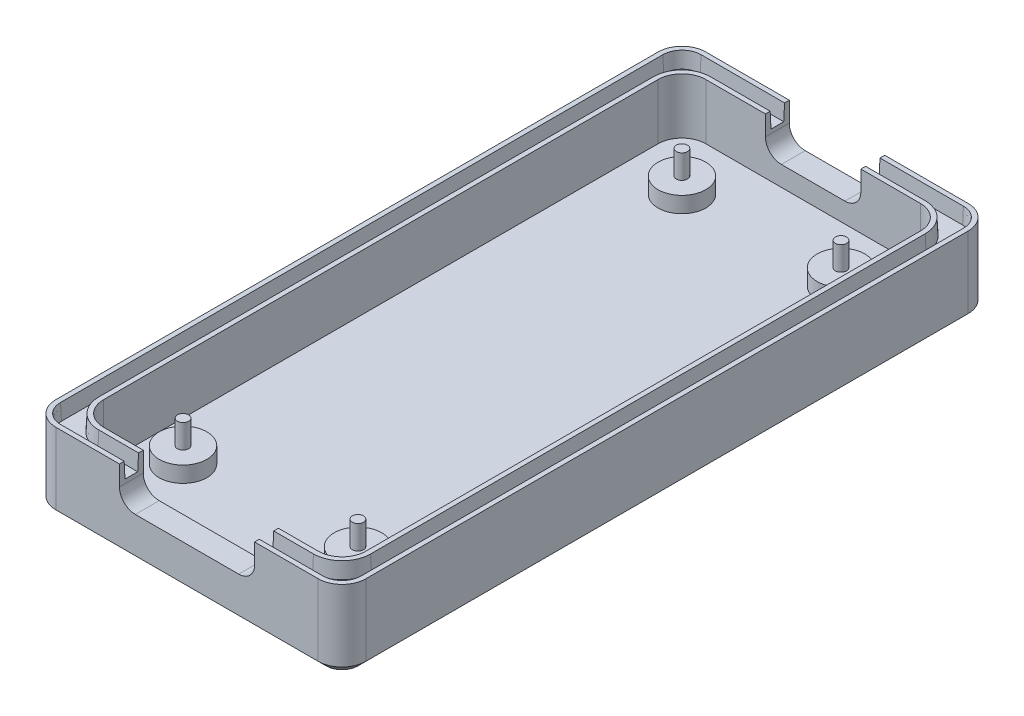
from build123d import *

# Parameters (mm, degrees)
SKETCH1_W                       = 39
SKETCH1_H                       = 81.75
SKETCH1_R                       = 3
BOSS_EXTRUDE1_DEPTH             = 3
SKETCH3_W                       = 39
SKETCH3_H                       = 81.75
SKETCH3_W_2                     = 33
SKETCH3_H_2                     = 75.75
BOSS_EXTRUDE3_DEPTH             = 5
BOSS_EXTRUDE4_START             = 3
SKETCH1_3_R                     = 3
BOSS_EXTRUDE4_DEPTH             = 2
SKETCH8_R                       = 0.7
BOARD_MOUNTING_STANDOFFS_DEPTH  = 3
TAP_DRILL_FOR_M2X0_4_TAP1_D     = 1.6
TAP_DRILL_FOR_M2X0_4_TAP1_DEPTH = 4.519311505
TAP_DRILL_FOR_M2X0_4_TAP1_TIP   = 0.480688495
FILLET2_R                       = 3
SKETCH6_W                       = 12
SKETCH6_H                       = 3
SKETCH6_W_2                     = 17
CUT_EXTRUDE1_DEPTH              = 2.5
STANDOFFS1_LIP_START            = 8
STANDOFFS1_LIP_DEPTH            = 2
STANDOFFS2_LIP_START            = 8
STANDOFFS2_LIP_DEPTH            = 2
FILLET4_R                       = 2
CHAMFER1_SIZE                   = 1


with BuildPart() as part:
    # Sketch1 → Boss-Extrude1 (new body)
    # profile 1 of 5: a face of its own
    with BuildSketch(Plane(origin=(0, 0, 0), x_dir=(1, 0, 0), z_dir=(0, 1, 0))):
        with Locations((14.5, 35.875)):
            Rectangle(SKETCH1_W, SKETCH1_H)
        with Locations((3, 6)):
            Circle(SKETCH1_R, mode=Mode.SUBTRACT)
        with Locations((25, 6)):
            Circle(SKETCH1_R, mode=Mode.SUBTRACT)
        with Locations((5, 66.75)):
            Circle(SKETCH1_R, mode=Mode.SUBTRACT)
        with Locations((25, 66.75)):
            Circle(SKETCH1_R, mode=Mode.SUBTRACT)
    # profile 2 of 5: a face of its own
    with BuildSketch(Plane(origin=(0, 0, 0), x_dir=(1, 0, 0), z_dir=(0, 1, 0))):
        with Locations((5, 66.75)):
            Circle(SKETCH1_R)
    # profile 3 of 5: a face of its own
    with BuildSketch(Plane(origin=(0, 0, 0), x_dir=(1, 0, 0), z_dir=(0, 1, 0))):
        with Locations((25, 66.75)):
            Circle(SKETCH1_R)
    # profile 4 of 5: a face of its own
    with BuildSketch(Plane(origin=(0, 0, 0), x_dir=(1, 0, 0), z_dir=(0, 1, 0))):
        with Locations((25, 6)):
            Circle(SKETCH1_R)
    # profile 5 of 5: a face of its own
    with BuildSketch(Plane(origin=(0, 0, 0), x_dir=(1, 0, 0), z_dir=(0, 1, 0))):
        with Locations((3, 6)):
            Circle(SKETCH1_R)
    extrude(amount=BOSS_EXTRUDE1_DEPTH)

    # Sketch3 → Boss-Extrude3 (add)
    with BuildSketch(Plane(origin=(0, 3, 0), x_dir=(1, 0, 0), z_dir=(0, 1, 0))):
        with Locations((14.5, 35.875)):
            Rectangle(SKETCH3_W, SKETCH3_H)
        with Locations((14.5, 35.875)):
            Rectangle(SKETCH3_W_2, SKETCH3_H_2, mode=Mode.SUBTRACT)
    extrude(amount=BOSS_EXTRUDE3_DEPTH)

    # Sketch1<3> → Boss-Extrude4 (add)
    with BuildSketch(Plane(origin=(0, 0, 0), x_dir=(1, 0, 0), z_dir=(0, 1, 0)).offset(BOSS_EXTRUDE4_START)):
        with Locations(Location((3, 6, 0), (0, 0, 270))):
            Circle(SKETCH1_3_R)
        with Locations(Location((25, 6, 0), (0, 0, 270))):
            Circle(SKETCH1_3_R)
        with Locations(Location((25, 66.75, 0), (0, 0, 270))):
            Circle(SKETCH1_3_R)
        with Locations(Location((5, 66.75, 0), (0, 0, 270))):
            Circle(SKETCH1_3_R)
    extrude(amount=BOSS_EXTRUDE4_DEPTH)

    # Sketch8 → Board Mounting Standoffs (add)
    with BuildSketch(Plane(origin=(0, 5, 0), x_dir=(1, 0, 0), z_dir=(0, 1, 0))):
        with Locations(Location((5, 66.75, 0), (0, 0, 270))):
            Circle(SKETCH8_R)
        with Locations(Location((25, 66.75, 0), (0, 0, 270))):
            Circle(SKETCH8_R)
        with Locations(Location((3, 6, 0), (0, 0, 270))):
            Circle(SKETCH8_R)
        with Locations(Location((25, 6, 0), (0, 0, 270))):
            Circle(SKETCH8_R)
    extrude(amount=BOARD_MOUNTING_STANDOFFS_DEPTH)

    # Tap Drill for M2x0.4 Tap1
    with Locations(Plane(origin=(0, 0, 0), x_dir=(-1, 0, 0), z_dir=(0, -1, 0))):
        with Locations((-25, 66.75), (-5, 66.75), (-25, 6), (-3, 6)):
            Hole(TAP_DRILL_FOR_M2X0_4_TAP1_D / 2, depth=TAP_DRILL_FOR_M2X0_4_TAP1_DEPTH)
            with Locations((0, 0, -(TAP_DRILL_FOR_M2X0_4_TAP1_DEPTH + TAP_DRILL_FOR_M2X0_4_TAP1_TIP / 2))):  # 118° drill point
                Cone(0, TAP_DRILL_FOR_M2X0_4_TAP1_D / 2, TAP_DRILL_FOR_M2X0_4_TAP1_TIP, mode=Mode.SUBTRACT)

    # Fillet2
    fillet2_edges = [part.edges().sort_by_distance(p)[0] for p in [
        (-2, 5.5, -73.75),
        (-2, 5.5, 2),
        (31, 5.5, 2),
        (31, 5.5, -73.75),
        (-5, 4, -76.75),
        (34, 4, -76.75),
        (34, 4, 5),
        (-5, 4, 5),
    ]]
    fillet(fillet2_edges, radius=FILLET2_R)

    # Sketch6 → Cut-Extrude1 (cut)
    with BuildSketch(Plane(origin=(0, 8, 0), x_dir=(1, 0, 0), z_dir=(0, 1, 0))):
        with Locations((14.5, 75.25)):
            Rectangle(SKETCH6_W, SKETCH6_H)
        with Locations((14.5, -3.5)):
            Rectangle(SKETCH6_W_2, SKETCH6_H)
    extrude(amount=-CUT_EXTRUDE1_DEPTH, mode=Mode.SUBTRACT)

    # Standoffs1-Lip: read off the stored shape, not the designer's step
    # Standoffs1-Lip outline → Standoffs1-Lip (add)
    with BuildSketch(Plane(origin=(0, 0, 0), x_dir=(1, 0, 0), z_dir=(0, 1, 0)).offset(STANDOFFS1_LIP_START)):
        with BuildLine():
            Line((23, -5), (31, -5))
            ThreePointArc((31, -5), (33.121320344, -4.121320344), (34, -2))
            Line((34, -2), (34, 73.75))
            ThreePointArc((34, 73.75), (33.121320344, 75.871320344), (31, 76.75))
            Line((31, 76.75), (20.5, 76.75))
            Line((20.5, 76.75), (20.5, 73.75))
            Line((20.5, 73.75), (28, 73.75))
            ThreePointArc((28, 73.75), (30.121320344, 72.871320344), (31, 70.75))
            Line((31, 70.75), (31, 1))
            ThreePointArc((31, 1), (30.121320344, -1.121320344), (28, -2))
            Line((28, -2), (23, -2))
            Line((23, -2), (23, -5))
        make_face()
    extrude(amount=STANDOFFS1_LIP_DEPTH)

    # Standoffs1-Lip 2: loft between two sections, ruled curve by curve
    standoffs1_lip_2_from = [
        Edge.make_three_point_arc((33.3, 8, -73.75), (32.626345597, 8, -75.376345597), (31, 8, -76.05)),
        Edge.make_three_point_arc((31, 8, 4.3), (32.626345597, 8, 3.626345597), (33.3, 8, 2)),
        Edge.make_three_point_arc((31.7, 8, -1), (30.61629509, 8, 1.61629509), (28, 8, 2.7)),
        Edge.make_three_point_arc((28, 8, -74.45), (30.61629509, 8, -73.36629509), (31.7, 8, -70.75)),
        Edge.make_line((20.5, 8, -76.05), (31, 8, -76.05)),
        Edge.make_line((33.3, 8, -73.75), (33.3, 8, 2)),
        Edge.make_line((31, 8, 4.3), (23, 8, 4.3)),
        Edge.make_line((20.5, 8, -74.45), (28, 8, -74.45)),
        Edge.make_line((28, 8, 2.7), (23, 8, 2.7)),
        Edge.make_line((31.7, 8, -70.75), (31.7, 8, -1)),
        Edge.make_line((20.5, 8, -74.45), (20.5, 8, -76.05)),
        Edge.make_line((23, 8, 2.7), (23, 8, 4.3)),
    ]
    standoffs1_lip_2_to = [
        Edge.make_three_point_arc((33.404815559, 10, -73.75), (32.700461389, 10, -75.450461389), (31, 10, -76.154815559)),
        Edge.make_three_point_arc((31, 10, 4.404815559), (32.700461389, 10, 3.700461389), (33.404815559, 10, 2)),
        Edge.make_three_point_arc((31.595184441, 10, -1), (30.542179298, 10, 1.542179298), (28, 10, 2.595184441)),
        Edge.make_three_point_arc((28, 10, -74.345184441), (30.542179298, 10, -73.292179298), (31.595184441, 10, -70.75)),
        Edge.make_line((20.5, 10, -76.154815559), (31, 10, -76.154815559)),
        Edge.make_line((33.404815559, 10, -73.75), (33.404815559, 10, 2)),
        Edge.make_line((31, 10, 4.404815559), (23, 10, 4.404815559)),
        Edge.make_line((20.5, 10, -74.345184441), (28, 10, -74.345184441)),
        Edge.make_line((28, 10, 2.595184441), (23, 10, 2.595184441)),
        Edge.make_line((31.595184441, 10, -70.75), (31.595184441, 10, -1)),
        Edge.make_line((20.5, 10, -74.345184441), (20.5, 10, -76.154815559)),
        Edge.make_line((23, 10, 2.595184441), (23, 10, 4.404815559)),
    ]
    standoffs1_lip_2 = Solid(Shell([*[Face.make_surface_from_curves(standoffs1_lip_2_from[k], standoffs1_lip_2_to[k]) for k in range(12)], Face(Wire(standoffs1_lip_2_from)), Face(Wire(standoffs1_lip_2_to))]))
    add(standoffs1_lip_2, mode=Mode.SUBTRACT)

    # Standoffs2-Lip: read off the stored shape, not the designer's step
    # Standoffs2-Lip outline → Standoffs2-Lip (add)
    with BuildSketch(Plane(origin=(0, 0, 0), x_dir=(1, 0, 0), z_dir=(0, 1, 0)).offset(STANDOFFS2_LIP_START)):
        with BuildLine():
            ThreePointArc((-2, 76.75), (-4.121320344, 75.871320344), (-5, 73.75))
            Line((-5, 73.75), (-5, -2))
            ThreePointArc((-5, -2), (-4.121320344, -4.121320344), (-2, -5))
            Line((-2, -5), (6, -5))
            Line((6, -5), (6, -2))
            Line((6, -2), (1, -2))
            ThreePointArc((1, -2), (-1.121320344, -1.121320344), (-2, 1))
            Line((-2, 1), (-2, 70.75))
            ThreePointArc((-2, 70.75), (-1.121320344, 72.871320344), (1, 73.75))
            Line((1, 73.75), (8.5, 73.75))
            Line((8.5, 73.75), (8.5, 76.75))
            Line((8.5, 76.75), (-2, 76.75))
        make_face()
    extrude(amount=STANDOFFS2_LIP_DEPTH)

    # Standoffs2-Lip 2: loft between two sections, ruled curve by curve
    standoffs2_lip_2_from = [
        Edge.make_three_point_arc((-4.3, 8, 2), (-3.626345597, 8, 3.626345597), (-2, 8, 4.3)),
        Edge.make_three_point_arc((-2, 8, -76.05), (-3.626345597, 8, -75.376345597), (-4.3, 8, -73.75)),
        Edge.make_three_point_arc((-2.7, 8, -70.75), (-1.61629509, 8, -73.36629509), (1, 8, -74.45)),
        Edge.make_three_point_arc((1, 8, 2.7), (-1.61629509, 8, 1.61629509), (-2.7, 8, -1)),
        Edge.make_line((-2, 8, -76.05), (8.5, 8, -76.05)),
        Edge.make_line((6, 8, 4.3), (-2, 8, 4.3)),
        Edge.make_line((1, 8, -74.45), (8.5, 8, -74.45)),
        Edge.make_line((6, 8, 2.7), (1, 8, 2.7)),
        Edge.make_line((-4.3, 8, 2), (-4.3, 8, -73.75)),
        Edge.make_line((-2.7, 8, -1), (-2.7, 8, -70.75)),
        Edge.make_line((8.5, 8, -74.45), (8.5, 8, -76.05)),
        Edge.make_line((6, 8, 2.7), (6, 8, 4.3)),
    ]
    standoffs2_lip_2_to = [
        Edge.make_three_point_arc((-4.404815559, 10, 2), (-3.700461389, 10, 3.700461389), (-2, 10, 4.404815559)),
        Edge.make_three_point_arc((-2, 10, -76.154815559), (-3.700461389, 10, -75.450461389), (-4.404815559, 10, -73.75)),
        Edge.make_three_point_arc((-2.595184441, 10, -70.75), (-1.542179298, 10, -73.292179298), (1, 10, -74.345184441)),
        Edge.make_three_point_arc((1, 10, 2.595184441), (-1.542179298, 10, 1.542179298), (-2.595184441, 10, -1)),
        Edge.make_line((-2, 10, -76.154815559), (8.5, 10, -76.154815559)),
        Edge.make_line((6, 10, 4.404815559), (-2, 10, 4.404815559)),
        Edge.make_line((1, 10, -74.345184441), (8.5, 10, -74.345184441)),
        Edge.make_line((6, 10, 2.595184441), (1, 10, 2.595184441)),
        Edge.make_line((-4.404815559, 10, 2), (-4.404815559, 10, -73.75)),
        Edge.make_line((-2.595184441, 10, -1), (-2.595184441, 10, -70.75)),
        Edge.make_line((8.5, 10, -74.345184441), (8.5, 10, -76.154815559)),
        Edge.make_line((6, 10, 2.595184441), (6, 10, 4.404815559)),
    ]
    standoffs2_lip_2 = Solid(Shell([*[Face.make_surface_from_curves(standoffs2_lip_2_from[k], standoffs2_lip_2_to[k]) for k in range(12)], Face(Wire(standoffs2_lip_2_from)), Face(Wire(standoffs2_lip_2_to))]))
    add(standoffs2_lip_2, mode=Mode.SUBTRACT)

    # Fillet4
    fillet4_edges = [part.edges().sort_by_distance(p)[0] for p in [
        (8.5, 5.5, -75.25),
        (20.5, 5.5, -75.25),
        (6, 5.5, 3.5),
        (23, 5.5, 3.5),
    ]]
    fillet(fillet4_edges, radius=FILLET4_R)

    # Chamfer1
    chamfer1_edges = [part.edges().sort_by_distance(p)[0] for p in [
        (34, 0, -35.875),
        (-5, 0, -35.875),
        (14.5, 0, -76.75),
        (14.5, 0, 5),
        (33.121320344, 0, -75.871320344),
        (-4.121320344, 0, -75.871320344),
        (-4.121320344, 0, 4.121320344),
        (33.121320344, 0, 4.121320344),
    ]]
    chamfer(chamfer1_edges, length=CHAMFER1_SIZE)


solid = part.part
